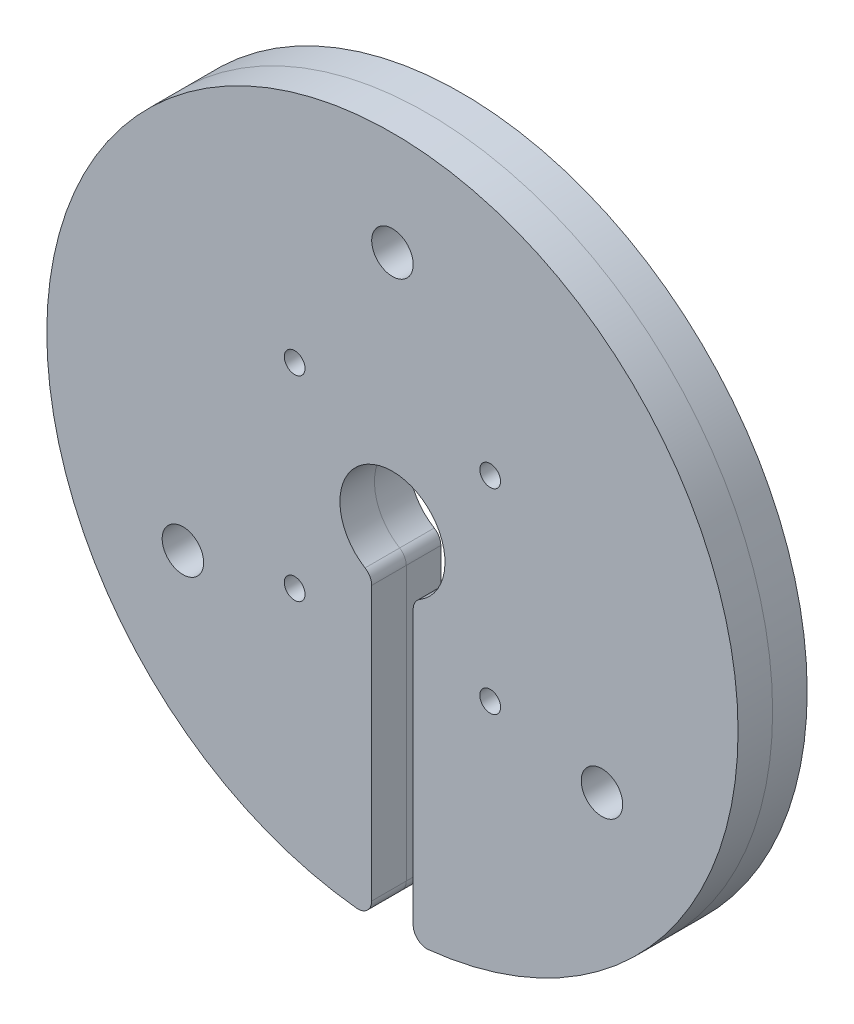
from build123d import *

# Parameters (mm, degrees)
BODY_MOVE_COPY2_START     = 24.896087842
BODY_MOVE_COPY2_OUTLINE_R = 1.5
BODY_MOVE_COPY2_OUTLINE_W = 5
BODY_MOVE_COPY2_OUTLINE_H = 5
BODY_MOVE_COPY2_DEPTH     = 5
SKETCH2_R                 = 3
SKETCH2_R_2               = 1.5
BOSS_EXTRUDE1_DEPTH       = 5


# Read off the part's stored shape, not the designer's step: Body-Move/Copy2
with BuildPart() as part:
    # Body-Move/Copy2 outline → Body-Move/Copy2 (new body)
    with BuildSketch(Plane.XY.offset(BODY_MOVE_COPY2_START)):
        with BuildLine():
            ThreePointArc((-22.026273853, -30.062216719), (-22.282236391, -29.083271708), (-22.984607186, -28.354899948))
            ThreePointArc((-22.984607186, -28.354899948), (-19.026273852, -14.267096219), (-15.067940519, -28.354899948))
            ThreePointArc((-15.067940519, -28.354899948), (-15.770311314, -29.083271708), (-16.026273853, -30.062216719))
            Line((-16.026273853, -30.062216719), (-16.026273853, -69.605969269))
            ThreePointArc((-16.026273853, -69.605969269), (-15.364805386, -71.092015477), (-13.817940519, -71.595088979))
            ThreePointArc((-13.817940519, -71.595088979), (-19.026273853, 28.132903781), (-24.234607186, -71.595088979))
            ThreePointArc((-24.234607186, -71.595088979), (-22.687742319, -71.092015477), (-22.026273853, -69.605969269))
            Line((-22.026273853, -69.605969269), (-22.026273853, -30.062216719))
        make_face()
        Polygon((-59.247417023, -42.20203271), (-54.917290004, -39.70203271), (-52.417290004, -44.032159729), (-56.747417023, -46.532159729), align=None, mode=Mode.SUBTRACT)
        with Locations((-49.337162985, -39.367096219)):
            Circle(BODY_MOVE_COPY2_OUTLINE_R, mode=Mode.SUBTRACT)
        Polygon((-39.426908947, -36.532159729), (-43.757035966, -39.032159729), (-46.257035966, -34.70203271), (-41.926908947, -32.20203271), align=None, mode=Mode.SUBTRACT)
        with Locations((-33.168409476, -36.009231843)):
            Circle(BODY_MOVE_COPY2_OUTLINE_R, mode=Mode.SUBTRACT)
        with Locations((-4.884138229, -36.009231843)):
            Circle(BODY_MOVE_COPY2_OUTLINE_R, mode=Mode.SUBTRACT)
        Polygon((3.874361242, -32.20203271), (8.204488261, -34.70203271), (5.704488261, -39.032159729), (1.374361242, -36.532159729), align=None, mode=Mode.SUBTRACT)
        Polygon((18.694869318, -46.532159729), (14.364742299, -44.032159729), (16.864742299, -39.70203271), (21.194869318, -42.20203271), align=None, mode=Mode.SUBTRACT)
        with Locations((11.28461528, -39.367096219)):
            Circle(BODY_MOVE_COPY2_OUTLINE_R, mode=Mode.SUBTRACT)
        with Locations((-33.168409476, -7.724960596)):
            Circle(BODY_MOVE_COPY2_OUTLINE_R, mode=Mode.SUBTRACT)
        with Locations((-19.026273853, 5.632903781)):
            Rectangle(BODY_MOVE_COPY2_OUTLINE_W, BODY_MOVE_COPY2_OUTLINE_H, mode=Mode.SUBTRACT)
        with Locations((-19.026273853, 13.132903781)):
            Circle(BODY_MOVE_COPY2_OUTLINE_R, mode=Mode.SUBTRACT)
        with Locations((-19.026273853, 20.632903781)):
            Rectangle(BODY_MOVE_COPY2_OUTLINE_W, BODY_MOVE_COPY2_OUTLINE_H, mode=Mode.SUBTRACT)
        with Locations((-4.884138229, -7.724960596)):
            Circle(BODY_MOVE_COPY2_OUTLINE_R, mode=Mode.SUBTRACT)
    extrude(amount=BODY_MOVE_COPY2_DEPTH)


with BuildPart() as body_2:
    # Sketch2 → Boss-Extrude1 (new body)
    with BuildSketch(Plane.XY.offset(29.896087842)):
        with BuildLine():
            Line((-16.026273853, -30.062216719), (-16.026273853, -69.605969269))
            ThreePointArc((-16.026273853, -69.605969269), (-15.364805386, -71.092015477), (-13.817940519, -71.595088979))
            ThreePointArc((-13.817940519, -71.595088979), (-19.026273853, 28.132903781), (-24.234607186, -71.595088979))
            ThreePointArc((-24.234607186, -71.595088979), (-22.687742319, -71.092015477), (-22.026273853, -69.605969269))
            Line((-22.026273853, -69.605969269), (-22.026273853, -30.062216719))
            ThreePointArc((-22.026273853, -30.062216719), (-22.282236391, -29.083271708), (-22.984607186, -28.354899948))
            ThreePointArc((-22.984607186, -28.354899948), (-19.026273853, -14.267096219), (-15.067940519, -28.354899948))
            ThreePointArc((-15.067940519, -28.354899948), (-15.770311314, -29.083271708), (-16.026273853, -30.062216719))
        make_face()
        with Locations((-19.026273853, 13.132903781)):
            Circle(SKETCH2_R, mode=Mode.SUBTRACT)
        with Locations((11.28461528, -39.367096219)):
            Circle(SKETCH2_R, mode=Mode.SUBTRACT)
        with Locations((-49.337162985, -39.367096219)):
            Circle(SKETCH2_R, mode=Mode.SUBTRACT)
        with Locations((-33.168409476, -7.724960596)):
            Circle(SKETCH2_R_2, mode=Mode.SUBTRACT)
        with Locations((-4.884138229, -7.724960596)):
            Circle(SKETCH2_R_2, mode=Mode.SUBTRACT)
        with Locations((-4.884138229, -36.009231843)):
            Circle(SKETCH2_R_2, mode=Mode.SUBTRACT)
        with Locations((-33.168409476, -36.009231843)):
            Circle(SKETCH2_R_2, mode=Mode.SUBTRACT)
    extrude(amount=BOSS_EXTRUDE1_DEPTH)


solid = Compound([part.part, body_2.part])
